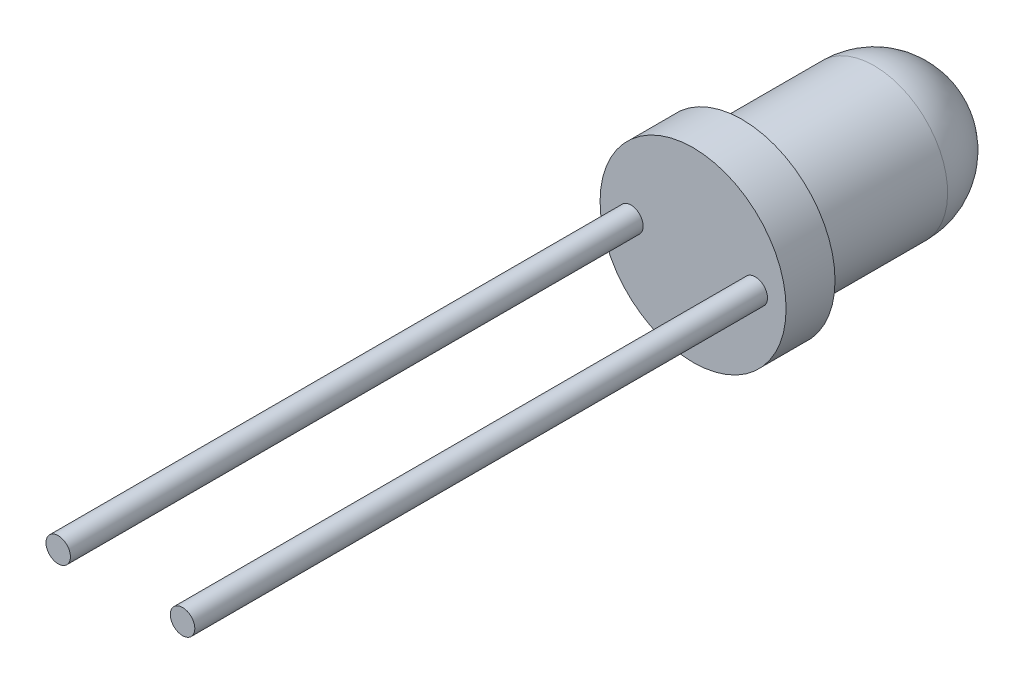
from build123d import *

# Parameters (mm, degrees)
SKETCH_1_R      = 1.5
EXTRUDE_1_DEPTH = 3.7
SKETCH_2_R      = 1.9
EXTRUDE_2_DEPTH = 1
SKETCH_3_R      = 0.25
EXTRUDE_3_DEPTH = 12.7


with BuildPart() as part:
    # 草图1 → 拉伸1 (new body)
    with BuildSketch(Plane.XY):
        Circle(SKETCH_1_R)
    extrude(amount=EXTRUDE_1_DEPTH)

    # 草图2 → 拉伸2 (add)
    with BuildSketch(Plane.XY.offset(3.7)):
        Circle(SKETCH_2_R)
    extrude(amount=-EXTRUDE_2_DEPTH)

    # 草图3 → 拉伸3 (add)
    with BuildSketch(Plane(origin=(0, 0, 2.7), x_dir=(-1, 0, 0), z_dir=(0, 0, -1))):
        with Locations((-1.27, 0)):
            Circle(SKETCH_3_R)
        with Locations((1.27, 0)):
            Circle(SKETCH_3_R)
    extrude(amount=-EXTRUDE_3_DEPTH)

    # 草图5 → 旋转2 (revolve)
    with BuildSketch(Plane(origin=(0, 0, 0), x_dir=(0, 0, -1), z_dir=(1, 0, 0))):
        with BuildLine():
            Line((0, 1.5), (0, 0))
            Line((0, 0), (1.5, 0))
            ThreePointArc((1.5, 0), (1.060660172, 1.060660172), (0, 1.5))
        make_face()
    revolve(axis=Axis((0, 0, -1.5), (0, 0, 1)))


solid = part.part
